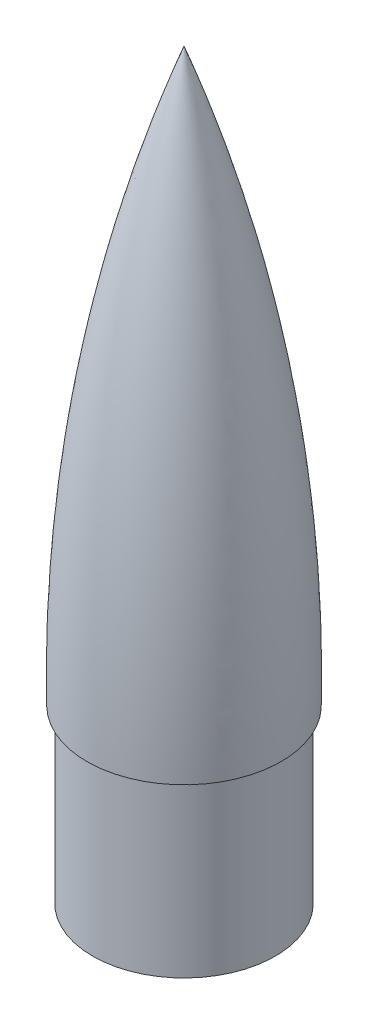
from build123d import *

# Parameters (mm, degrees)
SKETCH_1_R      = 16
SKETCH_1_R_2    = 15
EXTRUDE_1_DEPTH = 30


with BuildPart() as part:
    # Эскиз1 → Бобышка-Вытянуть1 (new body)
    with BuildSketch(Plane(origin=(0, 0, 0), x_dir=(1, 0, 0), z_dir=(0, 1, 0))):
        Circle(SKETCH_1_R)
        Circle(SKETCH_1_R_2, mode=Mode.SUBTRACT)
    extrude(amount=EXTRUDE_1_DEPTH)

    # Эскиз5 → Повернуть1 (revolve)
    with BuildSketch(Plane.XY):
        with BuildLine():
            Line((0, 30), (0, 130))
            ThreePointArc((0, 130), (-13.157936889, 80.791849271), (-17, 30))
            Line((-17, 30), (0, 30))
        make_face()
    revolve(axis=Axis((0, 100, 0), (0, -1, 0)))

    # Эскиз6 → Вырез-Повернуть1 (revolve, cut)
    with BuildSketch(Plane.XY):
        with BuildLine():
            Line((0, 128), (0, 30))
            Line((0, 30), (-15, 30))
            add(Edge.make_bspline(
                [(-15.031157371, 37.151771201), (-15.148384679, 32.18017582), (-15, 30)],
                knots=[0, 0, 0, 1, 1, 1], degree=2))
            ThreePointArc((-15.031157371, 37.151771201), (-12.64765752, 70.820234872), (-6.121243901, 103.935977998))
            add(Edge.make_bspline(
                [(0, 128), (-1.285260326, 123.677634701), (-2.143778885, 120.771879578), (-6.121243901, 103.935977998)],
                knots=[0, 0, 0, 0, 1, 1, 1, 1], degree=3))
        make_face()
    revolve(axis=Axis((0, 128, 0), (0, -1, 0)), mode=Mode.SUBTRACT)


solid = part.part
